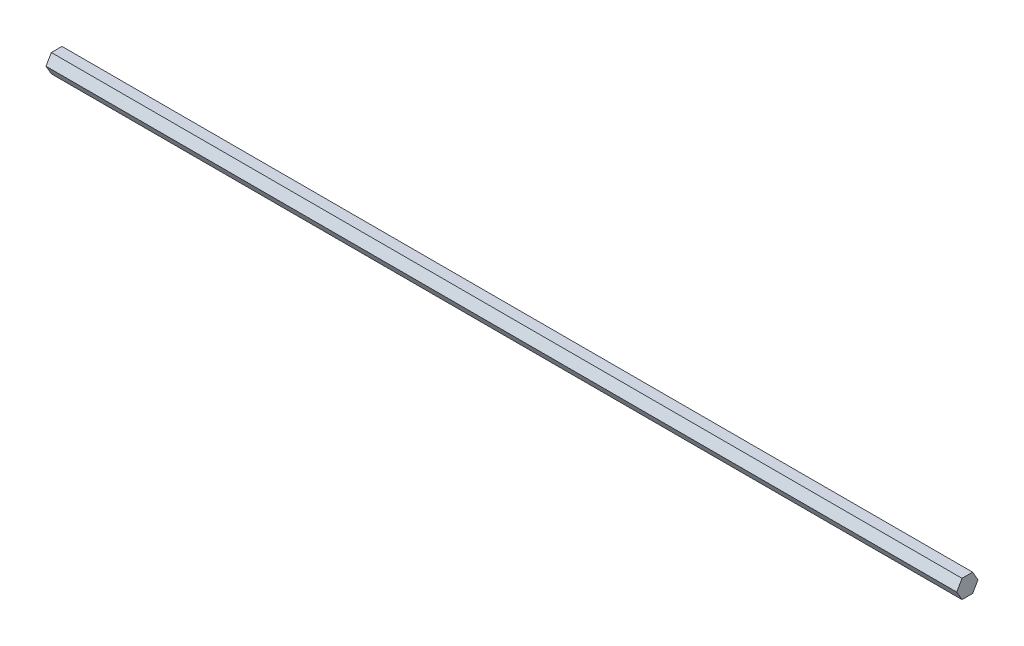
from build123d import *

# Parameters (mm, degrees)
BOSS_EXTRUDE1_DEPTH = 626.872


with BuildPart() as part:
    # Sketch1 → Boss-Extrude1 (new body)
    with BuildSketch(Plane(origin=(0, 0, 0), x_dir=(0, 0, -1), z_dir=(1, 0, 0))):
        Polygon((7.332348419, 0), (3.666174209, 6.35), (-3.666174209, 6.35), (-7.332348419, 0), (-3.666174209, -6.35), (3.666174209, -6.35), align=None)
    extrude(amount=BOSS_EXTRUDE1_DEPTH)


solid = part.part
